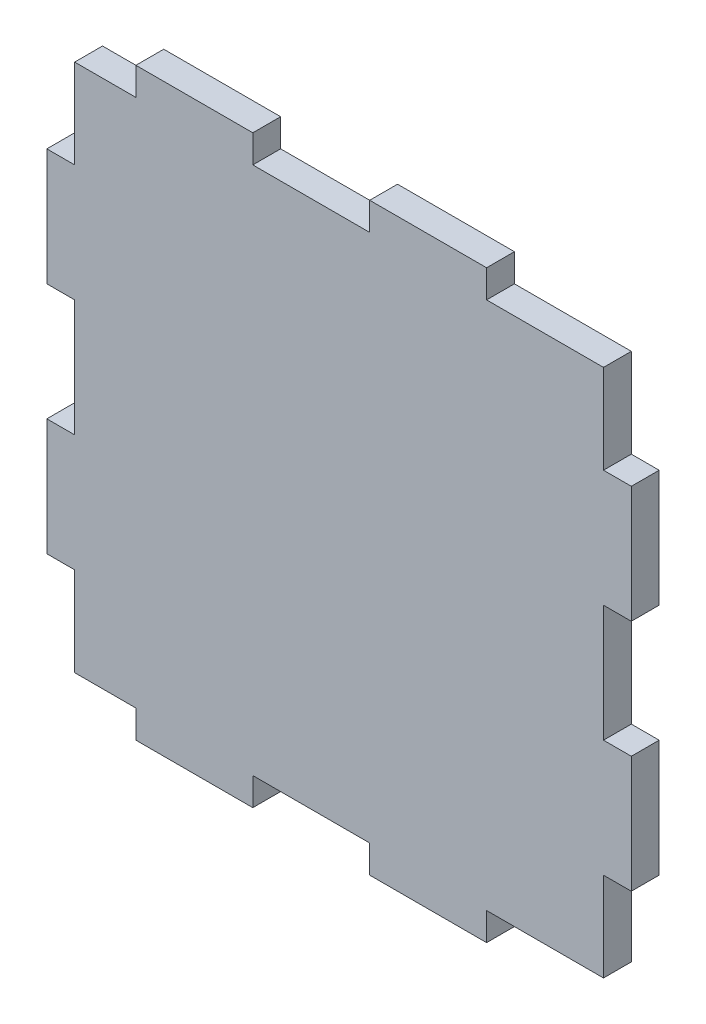
from build123d import *

# Parameters (mm, degrees)
SKETCH2_W           = 100
SKETCH2_H           = 100
BOSS_EXTRUDE1_DEPTH = 4.7625
CAVITY1_START       = -50
CAVITY1_OUTLINE_W   = 20
CAVITY1_OUTLINE_H   = 4.7625
CAVITY1_DEPTH       = 4.7625
CAVITY1_START_2     = 45.2375
CAVITY1_2_OUTLINE_W = 20
CAVITY1_2_OUTLINE_H = 4.7625
CAVITY1_2_DEPTH     = 4.7625
CAVITY1_START_3     = -14.7625
CAVITY1_3_OUTLINE_W = 4.7625
CAVITY1_3_OUTLINE_H = 4.7625
CAVITY1_3_DEPTH     = 20
CAVITY1_START_4     = 25.2375
CAVITY1_4_OUTLINE_W = 4.7625
CAVITY1_4_OUTLINE_H = 4.7625
CAVITY1_4_DEPTH     = 20
CAVITY1_START_5     = -45.2375
CAVITY1_5_OUTLINE_W = 4.7625
CAVITY1_5_OUTLINE_H = 4.7625
CAVITY1_5_DEPTH     = 10.475


# Read off the part's stored shape, not the designer's step: Cavity1
with BuildPart() as part:
    # Sketch2 → Boss-Extrude1 (new body)
    with BuildSketch(Plane.XY.offset(4.7625)):
        with Locations((0, 50)):
            Rectangle(SKETCH2_W, SKETCH2_H)
    extrude(amount=-BOSS_EXTRUDE1_DEPTH)

    # Cavity1 outline → Cavity1 (cut)
    with BuildSketch(Plane.YZ.offset(CAVITY1_START)):
        with Locations((10, 2.38125)):
            Rectangle(CAVITY1_OUTLINE_W, CAVITY1_OUTLINE_H)
        with Locations((50, 2.38125)):
            Rectangle(CAVITY1_OUTLINE_W, CAVITY1_OUTLINE_H)
        with Locations((90, 2.38125)):
            Rectangle(CAVITY1_OUTLINE_W, CAVITY1_OUTLINE_H)
    extrude(amount=CAVITY1_DEPTH, mode=Mode.SUBTRACT)

    # Cavity1 2 outline → Cavity1 2 (cut)
    with BuildSketch(Plane.YZ.offset(CAVITY1_START_2)):
        with Locations((10, 2.38125)):
            Rectangle(CAVITY1_2_OUTLINE_W, CAVITY1_2_OUTLINE_H)
        with Locations((50, 2.38125)):
            Rectangle(CAVITY1_2_OUTLINE_W, CAVITY1_2_OUTLINE_H)
        with Locations((90, 2.38125)):
            Rectangle(CAVITY1_2_OUTLINE_W, CAVITY1_2_OUTLINE_H)
    extrude(amount=CAVITY1_2_DEPTH, mode=Mode.SUBTRACT)

    # Cavity1 3 outline → Cavity1 3 (cut)
    with BuildSketch(Plane.YZ.offset(CAVITY1_START_3)):
        with Locations((2.38125, 2.38125)):
            Rectangle(CAVITY1_3_OUTLINE_W, CAVITY1_3_OUTLINE_H)
        with Locations((97.61875, 2.38125)):
            Rectangle(CAVITY1_3_OUTLINE_W, CAVITY1_3_OUTLINE_H)
    extrude(amount=CAVITY1_3_DEPTH, mode=Mode.SUBTRACT)

    # Cavity1 4 outline → Cavity1 4 (cut)
    with BuildSketch(Plane.YZ.offset(CAVITY1_START_4)):
        with Locations((2.38125, 2.38125)):
            Rectangle(CAVITY1_4_OUTLINE_W, CAVITY1_4_OUTLINE_H)
        with Locations((97.61875, 2.38125)):
            Rectangle(CAVITY1_4_OUTLINE_W, CAVITY1_4_OUTLINE_H)
    extrude(amount=CAVITY1_4_DEPTH, mode=Mode.SUBTRACT)

    # Cavity1 5 outline → Cavity1 5 (cut)
    with BuildSketch(Plane.YZ.offset(CAVITY1_START_5)):
        with Locations((2.38125, 2.38125)):
            Rectangle(CAVITY1_5_OUTLINE_W, CAVITY1_5_OUTLINE_H)
        with Locations((97.61875, 2.38125)):
            Rectangle(CAVITY1_5_OUTLINE_W, CAVITY1_5_OUTLINE_H)
    extrude(amount=CAVITY1_5_DEPTH, mode=Mode.SUBTRACT)


solid = part.part
